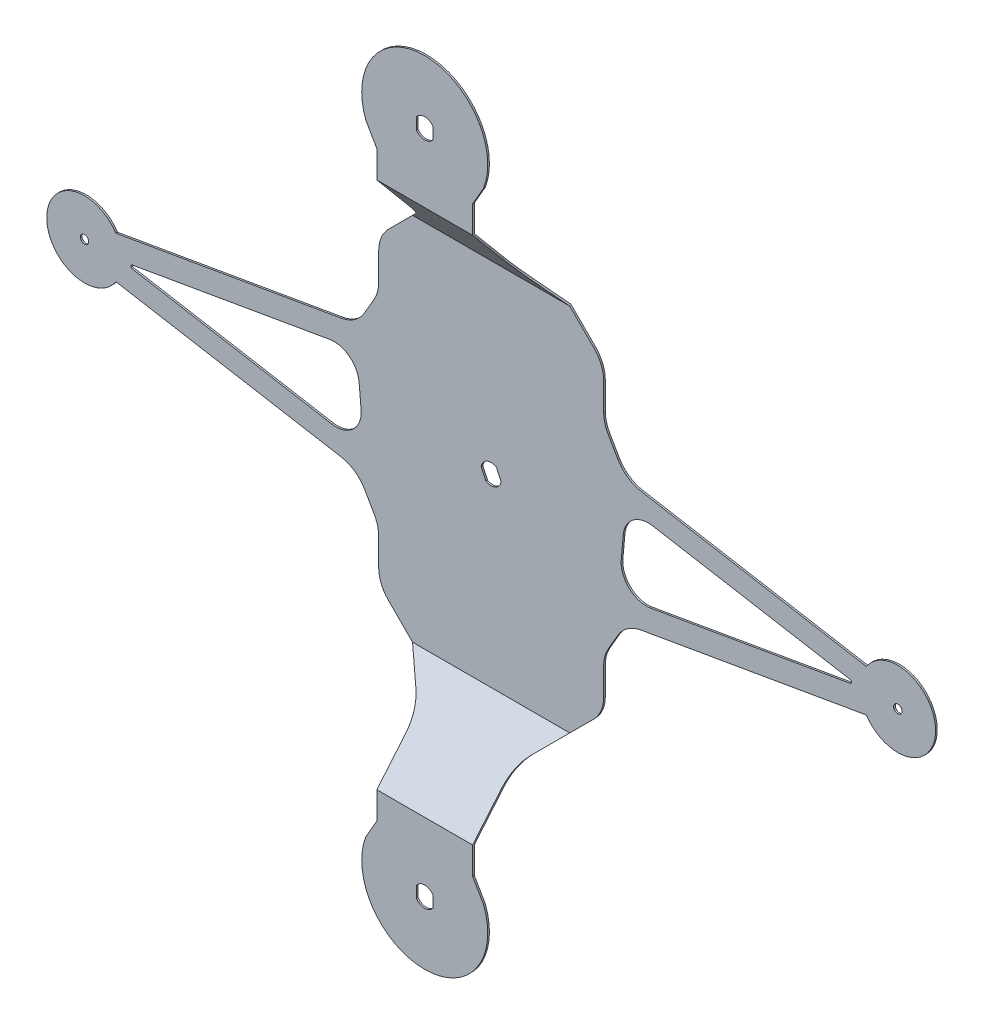
from build123d import *

# Parameters (mm, degrees)
SALIENTE_EXTRUIR1_DEPTH     = 271
CORTAR_EXTRUIR9_DEPTH       = 372.904084134
CORTAR_EXTRUIR9_DEPTH_BACK  = 372.904084134
CROQUIS4_R                  = 2.5
CORTAR_EXTRUIR10_DEPTH      = 372.904084134
CORTAR_EXTRUIR10_DEPTH_BACK = 372.904084134
CROQUIS2_W                  = 581.580028242
CROQUIS2_H                  = 554.061756016
REDONDEO1_R                 = 20
REDONDEO2_R                 = 15
REDONDEO3_R                 = 1


with BuildPart() as part:
    # Croquis1 → Saliente-Extruir1 (new, symmetric)
    with BuildSketch(Plane(origin=(0, 0, 0), x_dir=(0, 0, -1), z_dir=(1, 0, 0))):
        Polygon((-18.5, -110), (-18.5, 110), (-58.031437996, 157.111733252), (-58.031437996, 248), (-57.031437996, 248), (-57.031437996, 157.475703486), (-17.5, 110.363970234), (-17.5, -110.363970234), (-57.031437996, -157.475703486), (-57.031437996, -248), (-58.031437996, -248), (-58.031437996, -157.111733252), align=None)
    extrude(amount=SALIENTE_EXTRUIR1_DEPTH, both=True)

    # Croquis4 → Cortar-Extruir9 (cut, two sides: drawn at the far end of the back side and taken through both)
    with BuildSketch(Plane.XY.offset(-CORTAR_EXTRUIR9_DEPTH_BACK)):
        with Locations(Location((-242, 0, 0), (0, 0, 90))):
            Circle(CROQUIS4_R)
        with Locations(Location((242, 0, 0), (0, 0, 90))):
            Circle(CROQUIS4_R)
        with BuildLine():
            Line((-5, 201.31662479), (-5, 194.68337521))
            ThreePointArc((-5, 194.68337521), (0, 192), (5, 194.68337521))
            Line((5, 194.68337521), (5, 201.31662479))
            ThreePointArc((5, 201.31662479), (0, 204), (-5, 201.31662479))
        make_face()
        with BuildLine():
            Line((5, -201.31662479), (5, -194.68337521))
            ThreePointArc((5, -194.68337521), (0, -192), (-5, -194.68337521))
            Line((-5, -194.68337521), (-5, -201.31662479))
            ThreePointArc((-5, -201.31662479), (0, -204), (5, -201.31662479))
        make_face()
        with BuildLine():
            Line((-5.933205139, 0.892791565), (-3.129872731, -5.118974183))
            ThreePointArc((-3.129872731, -5.118974183), (2.53570957, -5.437846722), (5.933205139, -0.892791565))
            Line((5.933205139, -0.892791565), (3.129872731, 5.118974183))
            ThreePointArc((3.129872731, 5.118974183), (-2.53570957, 5.437846722), (-5.933205139, 0.892791565))
        make_face()
    extrude(amount=CORTAR_EXTRUIR9_DEPTH + CORTAR_EXTRUIR9_DEPTH_BACK, mode=Mode.SUBTRACT)

    # Croquis2 → Cortar-Extruir10 (cut, two sides: drawn at the far end of the back side and taken through both)
    # profile 1 of 3: a face of its own
    with BuildSketch(Plane.XY.offset(-CORTAR_EXTRUIR10_DEPTH_BACK)):
        Rectangle(CROQUIS2_W, CROQUIS2_H)
        with BuildLine():
            Line((80, 37.378360334), (223.291713066, 12.5))
            ThreePointArc((223.291713066, 12.5), (264.5, 0), (223.291713066, -12.5))
            Line((223.291713066, -12.5), (80, -37.378360334))
            Line((80, -37.378360334), (66.939390249, -60))
            Line((66.939390249, -60), (66.939390249, -89.839367484))
            Line((66.939390249, -89.839367484), (28.5, -128.278757733))
            Line((28.5, -128.278757733), (28.5, -173.278757733))
            Line((28.5, -173.278757733), (35, -184.537087982))
            ThreePointArc((35, -184.537087982), (0, -235.5), (-35, -184.537087982))
            Line((-35, -184.537087982), (-28.5, -173.278757733))
            Line((-28.5, -173.278757733), (-28.5, -128.278757733))
            Line((-28.5, -128.278757733), (-66.939390249, -89.839367484))
            Line((-66.939390249, -89.839367484), (-66.939390249, -60))
            Line((-66.939390249, -60), (-80, -37.378360334))
            Line((-80, -37.378360334), (-223.291713066, -12.5))
            ThreePointArc((-223.291713066, -12.5), (-264.5, 0), (-223.291713066, 12.5))
            Line((-223.291713066, 12.5), (-80, 37.378360334))
            Line((-80, 37.378360334), (-66.939390249, 60))
            Line((-66.939390249, 60), (-66.939390249, 89.839367484))
            Line((-66.939390249, 89.839367484), (-28.5, 128.278757733))
            Line((-28.5, 128.278757733), (-28.5, 173.278757733))
            Line((-28.5, 173.278757733), (-35, 184.537087982))
            ThreePointArc((-35, 184.537087982), (0, 235.5), (35, 184.537087982))
            Line((35, 184.537087982), (28.5, 173.278757733))
            Line((28.5, 173.278757733), (28.5, 128.278757733))
            Line((28.5, 128.278757733), (66.939390249, 89.839367484))
            Line((66.939390249, 89.839367484), (66.939390249, 60))
            Line((66.939390249, 60), (80, 37.378360334))
        make_face(mode=Mode.SUBTRACT)
    # profile 2 of 3: a face of its own
    with BuildSketch(Plane.XY.offset(-CORTAR_EXTRUIR10_DEPTH_BACK)):
        Polygon((-75.703100415, -24.92990815), (-80, -24.183878851), (-219.291713066, 0), (-80, 24.183878851), align=None)
    # profile 3 of 3: a face of its own
    with BuildSketch(Plane.XY.offset(-CORTAR_EXTRUIR10_DEPTH_BACK)):
        Polygon((80, 24.183878851), (75.703100415, -24.92990815), (80, -24.183878851), (219.291713066, 0), align=None)
    extrude(amount=CORTAR_EXTRUIR10_DEPTH + CORTAR_EXTRUIR10_DEPTH_BACK, mode=Mode.SUBTRACT)

    # Redondeo1
    # the kernel refuses this fillet: 20 mm, written as the material it adds along each edge
    with BuildSketch(Plane(origin=(-28.5, 128.278757733, 54.548376991), x_dir=(-0.7071067811865487, -0.7071067811865461, 0), z_dir=(0, 0, -1))) as redondeo1_piece_1_section:
        with BuildLine():
            CenterArc((REDONDEO1_R * 0.414213562373, REDONDEO1_R), REDONDEO1_R, 225, 45)
            Line((-REDONDEO1_R * 0.292893218813, REDONDEO1_R * 0.292893218813), (0, 0))
            Line((0, 0), (REDONDEO1_R * 0.414213562373, 0))
        make_face()
    redondeo1_piece_1 = extrude(amount=42.726763527, mode=Mode.PRIVATE)
    redondeo1_piece_1 = split(redondeo1_piece_1, bisect_by=Plane(origin=(-29.703304355, 128.455788912, 33.986245669), z_dir=(0, 0.6427876096865383, -0.7660444431189789)), keep=Keep.TOP, mode=Mode.PRIVATE)
    redondeo1_piece_1 = split(redondeo1_piece_1, bisect_by=Plane(origin=(-29.703304355, 129.098576521, 33.220201226), z_dir=(0, -0.6427876096865383, 0.766044443118979)), keep=Keep.TOP, mode=Mode.PRIVATE)
    add(redondeo1_piece_1)
    with BuildSketch(Plane(origin=(80, 37.378360334, 18.5), x_dir=(0.9852603921679417, -0.17106127447518257, 0), z_dir=(0, 0, -1)), Plane(origin=(80, -37.378360334, 18.5), x_dir=(-0.5000000000000011, -0.8660254037844379, 0), z_dir=(0, 0, -1)), Plane(origin=(-80, -37.378360334, 18.5), x_dir=(-0.9852603921679428, 0.17106127447517586, 0), z_dir=(0, 0, -1)), Plane(origin=(-80, 37.378360334, 18.5), x_dir=(0.5000000000000069, 0.8660254037844347, 0), z_dir=(0, 0, -1))) as redondeo1_piece_2:
        with BuildLine():
            CenterArc((REDONDEO1_R * 0.467907265941, -REDONDEO1_R), REDONDEO1_R, 90, 50.15047048)
            Line((-REDONDEO1_R * 0.299822625782, -REDONDEO1_R * 0.359226394617), (0, 0))
            Line((0, 0), (REDONDEO1_R * 0.467907265941, 0))
        make_face()
    extrude(amount=1)
    with BuildSketch(Plane(origin=(66.939390249, -60, 18.5), x_dir=(0, -1, 0), z_dir=(0, 0, -1)), Plane(origin=(-66.939390249, -60, 18.5), x_dir=(-0.5000000000000052, 0.8660254037844356, 0), z_dir=(0, 0, -1)), Plane(origin=(-66.939390249, 60, 18.5), x_dir=(0, 1, 0), z_dir=(0, 0, -1)), Plane(origin=(66.939390249, 60, 18.5), x_dir=(0.5000000000000032, -0.8660254037844367, 0), z_dir=(0, 0, -1))) as redondeo1_piece_3:
        with BuildLine():
            CenterArc((REDONDEO1_R * 0.267949192431, -REDONDEO1_R), REDONDEO1_R, 90, 30)
            Line((-REDONDEO1_R * 0.232050807569, -REDONDEO1_R * 0.133974596216), (0, 0))
            Line((0, 0), (REDONDEO1_R * 0.267949192431, 0))
        make_face()
    extrude(amount=1)
    with BuildSketch(Plane(origin=(28.5, 128.278757733, 54.548376991), x_dir=(0.7071067811865498, -0.7071067811865451, 0), z_dir=(0, 0, -1))) as redondeo1_piece_4_section:
        with BuildLine():
            CenterArc((REDONDEO1_R * 0.414213562373, -REDONDEO1_R), REDONDEO1_R, 90, 45)
            Line((-REDONDEO1_R * 0.292893218813, -REDONDEO1_R * 0.292893218813), (0, 0))
            Line((0, 0), (REDONDEO1_R * 0.414213562373, 0))
        make_face()
    redondeo1_piece_4 = extrude(amount=42.726763527, mode=Mode.PRIVATE)
    redondeo1_piece_4 = split(redondeo1_piece_4, bisect_by=Plane(origin=(29.703304355, 128.455788912, 33.986245669), z_dir=(0, 0.6427876096865383, -0.7660444431189789)), keep=Keep.TOP, mode=Mode.PRIVATE)
    redondeo1_piece_4 = split(redondeo1_piece_4, bisect_by=Plane(origin=(29.703304355, 129.098576521, 33.220201226), z_dir=(0, -0.6427876096865383, 0.766044443118979)), keep=Keep.TOP, mode=Mode.PRIVATE)
    add(redondeo1_piece_4)
    with BuildSketch(Plane(origin=(28.5, -128.278757733, 54.548376991), x_dir=(0.7071067811865518, 0.7071067811865431, 0), z_dir=(0, 0, -1))) as redondeo1_piece_5_section:
        with BuildLine():
            CenterArc((REDONDEO1_R * 0.414213562373, REDONDEO1_R), REDONDEO1_R, 225, 45)
            Line((-REDONDEO1_R * 0.292893218813, REDONDEO1_R * 0.292893218813), (0, 0))
            Line((0, 0), (REDONDEO1_R * 0.414213562373, 0))
        make_face()
    redondeo1_piece_5 = extrude(amount=42.726763527, mode=Mode.PRIVATE)
    redondeo1_piece_5 = split(redondeo1_piece_5, bisect_by=Plane(origin=(29.703304355, -128.455788912, 33.986245669), z_dir=(0, -0.6427876096865381, -0.766044443118979)), keep=Keep.TOP, mode=Mode.PRIVATE)
    redondeo1_piece_5 = split(redondeo1_piece_5, bisect_by=Plane(origin=(29.703304355, -129.098576521, 33.220201226), z_dir=(0, 0.6427876096865377, 0.7660444431189795)), keep=Keep.TOP, mode=Mode.PRIVATE)
    add(redondeo1_piece_5)
    with BuildSketch(Plane(origin=(-28.5, -128.278757733, 54.548376991), x_dir=(-0.7071067811865503, 0.7071067811865448, 0), z_dir=(0, 0, -1))) as redondeo1_piece_6_section:
        with BuildLine():
            CenterArc((REDONDEO1_R * 0.414213562373, -REDONDEO1_R), REDONDEO1_R, 90, 45)
            Line((-REDONDEO1_R * 0.292893218813, -REDONDEO1_R * 0.292893218813), (0, 0))
            Line((0, 0), (REDONDEO1_R * 0.414213562373, 0))
        make_face()
    redondeo1_piece_6 = extrude(amount=42.726763527, mode=Mode.PRIVATE)
    redondeo1_piece_6 = split(redondeo1_piece_6, bisect_by=Plane(origin=(-29.703304355, -128.455788912, 33.986245669), z_dir=(0, -0.6427876096865381, -0.766044443118979)), keep=Keep.TOP, mode=Mode.PRIVATE)
    redondeo1_piece_6 = split(redondeo1_piece_6, bisect_by=Plane(origin=(-29.703304355, -129.098576521, 33.220201226), z_dir=(0, 0.6427876096865377, 0.7660444431189795)), keep=Keep.TOP, mode=Mode.PRIVATE)
    add(redondeo1_piece_6)
    # the kernel refuses this fillet: 20 mm, written as the material it takes off along each edge
    with BuildSketch(Plane(origin=(-66.939390249, -89.839367484, 39.210678119), x_dir=(0, 1, 0), z_dir=(0, 0, -1)), Plane(origin=(-66.939390249, 89.839367484, 39.210678119), x_dir=(0.7071067811865483, 0.7071067811865467, 0), z_dir=(0, 0, -1)), Plane(origin=(66.939390249, 89.839367484, 39.210678119), x_dir=(0, -1, 0), z_dir=(0, 0, -1)), Plane(origin=(66.939390249, -89.839367484, 39.210678119), x_dir=(-0.7071067811865501, -0.707106781186545, 0), z_dir=(0, 0, -1))) as redondeo1_2_piece_1:
        with BuildLine():
            CenterArc((REDONDEO1_R * 0.414213562373, REDONDEO1_R), REDONDEO1_R, 225, 45)
            Line((-REDONDEO1_R * 0.292893218813, REDONDEO1_R * 0.292893218813), (0, 0))
            Line((0, 0), (REDONDEO1_R * 0.414213562373, 0))
        make_face()
    extrude(amount=42.421356237, mode=Mode.SUBTRACT)

    # Redondeo2
    redondeo2_edges = [part.edges().sort_by_distance(p)[0] for p in [
        (80, 24.183878851, 18),
        (75.703100415, -24.92990815, 18),
        (-75.703100415, -24.92990815, 18),
        (-80, 24.183878851, 18),
    ]]
    fillet(redondeo2_edges, radius=REDONDEO2_R)

    # Redondeo3
    redondeo3_edges = [part.edges().sort_by_distance(p)[0] for p in [
        (219.291713066, 0, 18),
        (-219.291713066, 0, 18),
    ]]
    fillet(redondeo3_edges, radius=REDONDEO3_R)


solid = part.part
